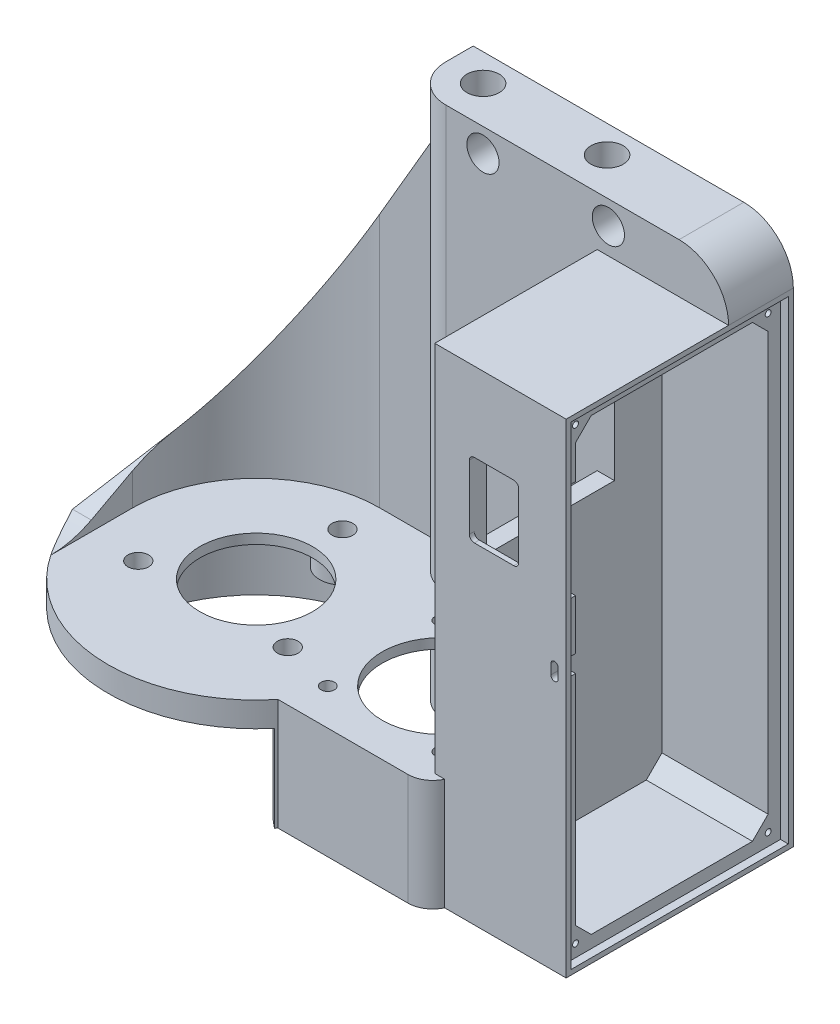
from build123d import *
from build123d.topology import SkipClean

# Parameters (mm, degrees)
SKETCH1_R                           = 12
SKETCH1_R_2                         = 11.425
BOSS_EXTRUDE1_DEPTH                 = 2
BOSS_EXTRUDE2_DEPTH                 = 73.934
BOSS_EXTRUDE2_DEPTH_BACK            = 21.066
M5X0_8_TAPPED_HOLE1_D               = 4.2
M2_5_CLEARANCE_HOLE1_D              = 2.7
BOSS_EXTRUDE4_DEPTH                 = 1.5
BOSS_EXTRUDE4_DEPTH_BACK            = 2
SKETCH8_W                           = 25
SKETCH8_H                           = 46
BOSS_EXTRUDE5_DEPTH                 = 1.5
BOSS_EXTRUDE5_DEPTH_BACK            = 2
SKETCH9_W                           = 25
SKETCH9_H                           = 46
BOSS_EXTRUDE34_DEPTH                = 21.5
BOSS_EXTRUDE17_DEPTH                = 38.21875
SKETCH44_W                          = 11.1125
SKETCH44_H                          = 62.3215
BOSS_EXTRUDE21_DEPTH                = 2
SKETCH46_W                          = 36.21875
SKETCH46_H                          = 11.1125
CUT_EXTRUDE12_DEPTH                 = 113.004120148
SKETCH47_W                          = 38.21875
SKETCH47_H                          = 13.1125
BOSS_EXTRUDE23_DEPTH                = 13.1125
BOSS_EXTRUDE22_DEPTH                = 71.775
F_1_4_CLEARANCE_HOLE3_D             = 6.5278
CUT_EXTRUDE5_DEPTH                  = 75.434
BOSS_EXTRUDE24_DEPTH                = 20.566
CUT_EXTRUDE13_START                 = -20.566
CUT_EXTRUDE13_DEPTH                 = 20.566
BOSS_EXTRUDE6_DEPTH                 = 5
CUT_EXTRUDE4_DEPTH                  = 113.004120148
BOSS_EXTRUDE7_REACH                 = 114.004
CUT_EXTRUDE8_DEPTH                  = 131.492286619
CUT_EXTRUDE8_DIRECTION_2_REACH      = 132.492
CUT_EXTRUDE8_DIRECTION_2_END_RADIUS = 25
BOSS_EXTRUDE15_START                = 20.566
BOSS_EXTRUDE15_DEPTH                = 20.566
SKETCH41_W                          = 29.3875
SKETCH41_H                          = 20
CUT_EXTRUDE10_DEPTH                 = 116.50578228
SKETCH70_R                          = 0.595
CUT_EXTRUDE17_DEPTH                 = 10
CUT_EXTRUDE19_DEPTH                 = 3.5
SKETCH72_W                          = 2
SKETCH72_H                          = 17.526
CUT_REVOLVE1_ANGLE                  = 50
CUT_REVOLVE1_OTHER_WAY_ANGLE        = 70
BOSS_EXTRUDE37_START                = 4.54
SKETCH73_R                          = 4.6
SKETCH73_R_2                        = 2.1
BOSS_EXTRUDE37_DEPTH                = 4.54
CUT_EXTRUDE20_REACH                 = 136.443
SKETCH76_W                          = 2.5
SKETCH76_H                          = 20
SKETCH78_W                          = 46
SKETCH78_H                          = 98
SKETCH78_W_2                        = 44
SKETCH78_H_2                        = 96
BOSS_EXTRUDE38_DEPTH                = 1.6
SKETCH81_W                          = 0.75
SKETCH81_H                          = 20
BOSS_EXTRUDE41_DEPTH                = 1
SKETCH82_W                          = 0.75
SKETCH82_H                          = 3.5
CUT_EXTRUDE22_DEPTH                 = 2.5
SKETCH84_W                          = 1.5
SKETCH84_H                          = 2.8875
CUT_EXTRUDE23_DEPTH                 = 2
SKETCH85_R                          = 3.2639
BOSS_EXTRUDE43_DEPTH                = 10.025
F_1_4_CLEARANCE_HOLE4_D             = 6.5278
SKETCH89_R                          = 3.2639
CUT_EXTRUDE24_DEPTH                 = 10.025
FILLET1_R                           = 3
FILLET2_R                           = 5
CUT_EXTRUDE25_DEPTH                 = 126.322803244


with BuildPart() as part:
    # Sketch1 → Boss-Extrude1 (new body)
    with BuildSketch(Plane(origin=(0, 0, 0), x_dir=(1, 0, 0), z_dir=(0, 1, 0))):
        with BuildLine():
            Line((77.166278738, 30), (0, 30))
            ThreePointArc((0, 30), (-27.079743352, -12.910751334), (23.30798884, -18.8875))
            Line((23.30798884, -18.8875), (55.666278738, -18.8875))
            Line((55.666278738, -18.8875), (55.666278738, -16))
            Line((55.666278738, -16), (77.166278738, -16))
            Line((77.166278738, -16), (77.166278738, -12.5))
            Line((77.166278738, -12.5), (55.666278738, -12.5))
            Line((55.666278738, -12.5), (55.666278738, 26.5))
            Line((55.666278738, 26.5), (77.166278738, 26.5))
            Line((77.166278738, 26.5), (77.166278738, 30))
        make_face()
        with Locations(Location((37.5, 0, 0), (0, 0, 270))):
            Circle(SKETCH1_R, mode=Mode.SUBTRACT)
        with Locations(Location((0, 0, 0), (0, 0, 270))):
            Circle(SKETCH1_R_2, mode=Mode.SUBTRACT)
    extrude(amount=-BOSS_EXTRUDE1_DEPTH)

    # Sketch1<3> → Boss-Extrude2 (add, two sides: drawn at the far end of the back side and taken through both)
    with BuildSketch(Plane(origin=(0, 0, 0), x_dir=(1, 0, 0), z_dir=(0, 1, 0)).offset(-BOSS_EXTRUDE2_DEPTH_BACK)):
        Polygon((77.166278738, 30), (52.166278738, 30), (52.166278738, -16), (55.666278738, -16), (77.166278738, -16), (77.166278738, -12.5), (55.666278738, -12.5), (55.666278738, 26.5), (77.166278738, 26.5), align=None)
    extrude(amount=BOSS_EXTRUDE2_DEPTH + BOSS_EXTRUDE2_DEPTH_BACK)

    # M5x0.8 Tapped Hole1 (through all)
    with Locations(Plane(origin=(0, 0, 0), x_dir=(1, 0, 0), z_dir=(0, 1, 0))):
        with Locations((0, 17.475), (-15.133793931, -8.7375), (15.133793931, -8.7375)):
            Hole(M5X0_8_TAPPED_HOLE1_D / 2)

    # M2.5 Clearance Hole1 (through all)
    with Locations(Plane(origin=(0, 0, 0), x_dir=(1, 0, 0), z_dir=(0, 1, 0))):
        with Locations((26, 11.5), (49, 11.5), (49, -11.5), (26, -11.5)):
            Hole(M2_5_CLEARANCE_HOLE1_D / 2)

    # Sketch8 → Boss-Extrude4 (add, two sides: drawn at the far end of the back side and taken through both)
    with BuildSketch(Plane(origin=(0, 73.934, 0), x_dir=(1, 0, 0), z_dir=(0, 1, 0)).offset(-BOSS_EXTRUDE4_DEPTH_BACK)):
        with Locations((64.666278738, 7)):
            Rectangle(SKETCH8_W, SKETCH8_H)
    extrude(amount=BOSS_EXTRUDE4_DEPTH + BOSS_EXTRUDE4_DEPTH_BACK)

    # Sketch9 → Boss-Extrude5 (add, two sides: drawn at the far end of the back side and taken through both)
    with BuildSketch(Plane.XZ.offset(21.066).offset(-BOSS_EXTRUDE5_DEPTH_BACK)):
        with Locations((64.666278738, -7)):
            Rectangle(SKETCH9_W, SKETCH9_H)
    extrude(amount=BOSS_EXTRUDE5_DEPTH + BOSS_EXTRUDE5_DEPTH_BACK)

    # Sketch65 → Boss-Extrude34 (add)
    with BuildSketch(Plane(origin=(55.666278738, 0, 0), x_dir=(0, 0, -1), z_dir=(1, 0, 0))):
        Polygon((-12.5, 71.934), (-9.325, 71.934), (-12.5, 68.759), align=None)
        Polygon((26.5, 71.934), (23.325, 71.934), (26.5, 68.759), align=None)
        Polygon((26.5, -15.891), (23.325, -19.066), (26.5, -19.066), align=None)
        Polygon((-9.325, -19.066), (-12.5, -15.891), (-12.5, -19.066), align=None)
    extrude(amount=BOSS_EXTRUDE34_DEPTH)

    # Sketch28 → Boss-Extrude17 (add)
    with BuildSketch(Plane.ZY.offset(-52.166278738)):
        Polygon((-18.8875, 62.3215), (-30, 62.3215), (-30, 75.434), (-16.8875, 75.434), (-16.8875, 0), (-18.8875, 0), align=None)
    extrude(amount=BOSS_EXTRUDE17_DEPTH)

    # Sketch44 → Boss-Extrude21 (add)
    with BuildSketch(Plane.ZY.offset(-13.947528738)):
        with Locations((-24.44375, 31.16075)):
            Rectangle(SKETCH44_W, SKETCH44_H)
    extrude(amount=-BOSS_EXTRUDE21_DEPTH)

    # Sketch46 → Cut-Extrude12 (cut, through all)
    with BuildSketch(Plane(origin=(0, 0, 0), x_dir=(1, 0, 0), z_dir=(0, 1, 0))):
        with Locations((34.056903738, 24.44375)):
            Rectangle(SKETCH46_W, SKETCH46_H)
    extrude(amount=-CUT_EXTRUDE12_DEPTH, mode=Mode.SUBTRACT)

    # Sketch47 → Boss-Extrude23 (add)
    with BuildSketch(Plane.XZ.offset(22.566)):
        with Locations((33.056903738, -23.44375)):
            Rectangle(SKETCH47_W, SKETCH47_H)
    extrude(amount=-BOSS_EXTRUDE23_DEPTH)

    # Sketch45 → Boss-Extrude22 (add)
    with BuildSketch(Plane(origin=(0, -9.4535, 0), x_dir=(1, 0, 0), z_dir=(0, 1, 0))):
        with BuildLine():
            Line((21.503778738, 18.8875), (15.947528738, 18.8875))
            Line((15.947528738, 18.8875), (15.947528738, 24.44375))
            ThreePointArc((15.947528738, 24.44375), (17.574916685, 20.514887947), (21.503778738, 18.8875))
        make_face()
        with BuildLine():
            Line((52.166278738, 18.8875), (46.610028738, 18.8875))
            ThreePointArc((46.610028738, 18.8875), (50.538890791, 20.514887947), (52.166278738, 24.44375))
            Line((52.166278738, 24.44375), (52.166278738, 18.8875))
        make_face()
    extrude(amount=BOSS_EXTRUDE22_DEPTH)

    # 1/4 Clearance Hole3 (through all)
    with Locations(Plane(origin=(0, 75.434, 0), x_dir=(1, 0, 0), z_dir=(0, 1, 0))):
        with Locations((46.610028738, 24.44375), (21.503778738, 24.44375)):
            Hole(F_1_4_CLEARANCE_HOLE3_D / 2)

    # Sketch32 → Cut-Extrude5 (cut)
    with BuildSketch(Plane(origin=(0, 75.434, 0), x_dir=(1, 0, 0), z_dir=(0, 1, 0))):
        with BuildLine():
            Line((21.503778738, 16.8875), (13.947528738, 16.8875))
            Line((13.947528738, 16.8875), (13.947528738, 24.44375))
            ThreePointArc((13.947528738, 24.44375), (16.160703122, 19.100674385), (21.503778738, 16.8875))
        make_face()
    extrude(amount=-CUT_EXTRUDE5_DEPTH, mode=Mode.SUBTRACT)

    # Sketch48 → Boss-Extrude24 (add)
    with BuildSketch(Plane.XZ.offset(22.566)):
        Polygon((52.166278738, -18.8875), (52.166278738, -16.8875), (13.947528738, -16.8875), (13.947528738, -30), (15.947528738, -30), (15.947528738, -18.8875), align=None)
    extrude(amount=-BOSS_EXTRUDE24_DEPTH)

    # Sketch49 → Cut-Extrude13 (cut)
    with BuildSketch(Plane.XZ.offset(22.566).offset(CUT_EXTRUDE13_START)):
        with BuildLine():
            Line((13.947528738, -24.44375), (13.947528738, -16.8875))
            Line((13.947528738, -16.8875), (21.503778738, -16.8875))
            ThreePointArc((21.503778738, -16.8875), (16.160703122, -19.100674385), (13.947528738, -24.44375))
        make_face()
    extrude(amount=CUT_EXTRUDE13_DEPTH, mode=Mode.SUBTRACT)

    # Sketch12 → Boss-Extrude6 (add)
    with BuildSketch(Plane(origin=(0, 0, -30), x_dir=(-1, 0, 0), z_dir=(0, 0, -1))):
        Polygon((-13.947528738, 75.434), (30, 0), (-13.947528738, 0), align=None)
    extrude(amount=-BOSS_EXTRUDE6_DEPTH)

    # Sketch14 → Cut-Extrude4 (cut, through all)
    with BuildSketch(Plane.XZ):
        with BuildLine():
            ThreePointArc((0, -30), (-21.213203436, -21.213203436), (-30, 0))
            Line((-30, 0), (-30, -30))
            Line((-30, -30), (0, -30))
        make_face()
        with BuildLine():
            Line((-30, 30), (-30, 0))
            ThreePointArc((-30, 0), (-21.213203436, 21.213203436), (0, 30))
            Line((0, 30), (-30, 30))
        make_face()
    extrude(amount=-CUT_EXTRUDE4_DEPTH, mode=Mode.SUBTRACT)

    # Boss-Extrude7: up to this face of the body (flat: up to its plane)
    boss_extrude7_end = Plane(part.part.faces().sort_by_distance((1.048887243, 53.294049235, -27.283424516))[0])
    # Sketch17 → Boss-Extrude7 (add, up to the picked face)
    with BuildSketch(Plane(origin=(0, 0, 0), x_dir=(1, 0, 0), z_dir=(0, 1, 0)), mode=Mode.PRIVATE) as boss_extrude7_sk1:
        with BuildLine():
            Line((0, 25), (-16.583123952, 25))
            ThreePointArc((-16.583123952, 25), (-29.403708929, 5.95163013), (-25, -16.583123952))
            Line((-25, -16.583123952), (-25, 0))
            ThreePointArc((-25, 0), (-17.67766953, 17.67766953), (0, 25))
        make_face()
    boss_extrude7_tool1 = split(extrude(boss_extrude7_sk1.sketch, amount=BOSS_EXTRUDE7_REACH, mode=Mode.PRIVATE), bisect_by=boss_extrude7_end, keep=Keep.BOTH, mode=Mode.PRIVATE)
    add(boss_extrude7_tool1.solids().sort_by(Axis((-18.040241, 0, -18.040241), (0, 1, 0)))[0])

    # Sketch37 → Cut-Extrude8 (cut)
    with BuildSketch(Plane(origin=(-25, 0, 0), x_dir=(0, 0, -1), z_dir=(1, 0, 0))):
        with BuildLine():
            Line((-8.389768282, 2.054628266), (7.441644952, 10.52744792))
            Line((7.441644952, 10.52744792), (-16.583123952, 10.52744792))
            Line((-16.583123952, 10.52744792), (-16.583123952, 0))
            ThreePointArc((-16.583123952, 0), (-12.359601298, 0.521487976), (-8.389768282, 2.054628266))
        make_face()
    extrude(amount=-CUT_EXTRUDE8_DEPTH, mode=Mode.SUBTRACT)

    # Cut-Extrude8 direction 2: up to this cylinder (the profile starts outside it)
    cut_extrude8_direction_2_end = Plane(origin=(0, 6.542538, 0), z_dir=(0, -1, 0)) * Cylinder(CUT_EXTRUDE8_DIRECTION_2_END_RADIUS, 315.984, mode=Mode.PRIVATE)
    # Sketch37 → Cut-Extrude8 direction 2 (cut, up to the surface)
    with BuildSketch(Plane(origin=(-25, 0, 0), x_dir=(0, 0, -1), z_dir=(1, 0, 0)), mode=Mode.PRIVATE) as cut_extrude8_direction_2_sk1:
        with BuildLine():
            Line((-8.389768282, 2.054628266), (7.441644952, 10.52744792))
            Line((7.441644952, 10.52744792), (-16.583123952, 10.52744792))
            Line((-16.583123952, 10.52744792), (-16.583123952, 0))
            ThreePointArc((-16.583123952, 0), (-12.359601298, 0.521487976), (-8.389768282, 2.054628266))
        make_face()
    cut_extrude8_direction_2_tool1 = extrude(cut_extrude8_direction_2_sk1.sketch, amount=CUT_EXTRUDE8_DIRECTION_2_REACH, mode=Mode.PRIVATE) - cut_extrude8_direction_2_end
    add(cut_extrude8_direction_2_tool1.solids().sort_by_distance((-25, 6.542538, 8.31104))[0], mode=Mode.SUBTRACT)
    add(cut_extrude8_direction_2_tool1.solids().sort_by_distance((-25, 6.542538, 8.31104))[1], mode=Mode.SUBTRACT)

    # Sketch26 → Boss-Extrude15 (add)
    with BuildSketch(Plane.XZ.offset(2).offset(BOSS_EXTRUDE15_START)):
        with BuildLine():
            Line((13.947528738, -30), (0, -30))
            ThreePointArc((0, -30), (-27.079743352, 12.910751334), (23.30798884, 18.8875))
            Line((23.30798884, 18.8875), (52.166278738, 18.8875))
            Line((52.166278738, 18.8875), (54.166278738, 18.8875))
            Line((54.166278738, 18.8875), (54.166278738, 16))
            Line((54.166278738, 16), (52.166278738, 16))
            Line((52.166278738, 16), (52.166278738, 16.8875))
            Line((52.166278738, 16.8875), (22.334107185, 16.8875))
            ThreePointArc((22.334107185, 16.8875), (-25.068406411, 12.472970777), (0, -28))
            Line((0, -28), (13.947528738, -28))
            Line((13.947528738, -28), (13.947528738, -30))
        make_face()
    extrude(amount=-BOSS_EXTRUDE15_DEPTH)

    # Sketch41 → Cut-Extrude10 (cut, through all)
    with BuildSketch(Plane.ZY.offset(-52.166278738)):
        with Locations((-2.19375, 46.65972209)):
            Rectangle(SKETCH41_W, SKETCH41_H)
    extrude(amount=-CUT_EXTRUDE10_DEPTH, mode=Mode.SUBTRACT)

    # Sketch70 → Cut-Extrude17 (cut)
    with BuildSketch(Plane(origin=(77.166278738, 0, 0), x_dir=(0, 0, -1), z_dir=(1, 0, 0))):
        with Locations((-12.5, 71.934)):
            Circle(SKETCH70_R)
        with Locations((26.5, 71.934)):
            Circle(SKETCH70_R)
        with Locations((26.5, -19.066)):
            Circle(SKETCH70_R)
        with Locations((-12.5, -19.066)):
            Circle(SKETCH70_R)
    extrude(amount=-CUT_EXTRUDE17_DEPTH, mode=Mode.SUBTRACT)

    # Sketch71 → Cut-Extrude19 (cut)
    with BuildSketch(Plane.XY.offset(16)):
        with BuildLine():
            Line((60.166278738, 59.434), (68.166278738, 59.434))
            ThreePointArc((68.166278738, 59.434), (68.873385519, 59.141106781), (69.166278738, 58.434))
            Line((69.166278738, 58.434), (69.166278738, 45.434))
            ThreePointArc((69.166278738, 45.434), (68.873385519, 44.726893219), (68.166278738, 44.434))
            Line((68.166278738, 44.434), (60.166278738, 44.434))
            ThreePointArc((60.166278738, 44.434), (59.459171957, 44.726893219), (59.166278738, 45.434))
            Line((59.166278738, 45.434), (59.166278738, 58.434))
            ThreePointArc((59.166278738, 58.434), (59.459171957, 59.141106781), (60.166278738, 59.434))
        make_face()
        with BuildLine():
            Line((75.666278738, 31.034), (75.666278738, 29.034))
            ThreePointArc((75.666278738, 29.034), (76.416278738, 28.284), (77.166278738, 29.034))
            Line((77.166278738, 29.034), (77.166278738, 31.034))
            ThreePointArc((77.166278738, 31.034), (76.416278738, 31.784), (75.666278738, 31.034))
        make_face()
    extrude(amount=-CUT_EXTRUDE19_DEPTH, mode=Mode.SUBTRACT)

    # Sketch72 → Cut-Revolve1 (revolve, cut)
    with BuildSketch(Plane.ZY):
        with Locations((29, -13.803)):
            Rectangle(SKETCH72_W, SKETCH72_H)
    revolve(axis=Axis((0, -125.929254963, 0), (0, 1, 0)), revolution_arc=CUT_REVOLVE1_ANGLE, mode=Mode.SUBTRACT)

    # Sketch72 → Cut-Revolve1 other way (revolve, cut)
    with BuildSketch(Plane.ZY):
        with Locations((29, -13.803)):
            Rectangle(SKETCH72_W, SKETCH72_H)
    revolve(axis=Axis((0, -125.929254963, 0), (0, -1, 0)), revolution_arc=CUT_REVOLVE1_OTHER_WAY_ANGLE, mode=Mode.SUBTRACT)

    # Sketch73 → Boss-Extrude37 (add)
    # profile 1 of 3: a face of its own
    with BuildSketch(Plane.XZ.offset(2).offset(BOSS_EXTRUDE37_START)):
        with Locations(Location((-15.133793931, 8.7375, 0), (0, 0, 90))):
            Circle(SKETCH73_R)
        with Locations(Location((-15.133793931, 8.7375, 0), (0, 0, 90))):
            Circle(SKETCH73_R_2, mode=Mode.SUBTRACT)
    # profile 2 of 3: a face of its own
    with BuildSketch(Plane.XZ.offset(2).offset(BOSS_EXTRUDE37_START)):
        with Locations(Location((15.133793931, 8.7375, 0), (0, 0, 90))):
            Circle(SKETCH73_R)
        with Locations(Location((15.133793931, 8.7375, 0), (0, 0, 90))):
            Circle(SKETCH73_R_2, mode=Mode.SUBTRACT)
    # profile 3 of 3: a face of its own
    with BuildSketch(Plane.XZ.offset(2).offset(BOSS_EXTRUDE37_START)):
        with Locations(Location((0, -17.475, 0), (0, 0, 90))):
            Circle(SKETCH73_R)
        with Locations(Location((0, -17.475, 0), (0, 0, 90))):
            Circle(SKETCH73_R_2, mode=Mode.SUBTRACT)
    extrude(amount=-BOSS_EXTRUDE37_DEPTH)

    # Cut-Extrude20: up to this face of the body (flat: up to its plane)
    cut_extrude20_end = Plane(part.part.faces().sort_by_distance((59.166278738, 51.934, 14.25))[0])
    # Sketch76 → Cut-Extrude20 (cut, up to the picked face)
    with BuildSketch(Plane(origin=(77.166278738, 0, 0), x_dir=(0, 0, -1), z_dir=(1, 0, 0)), mode=Mode.PRIVATE) as cut_extrude20_sk1:
        with Locations((-13.75, 51.934)):
            Rectangle(SKETCH76_W, SKETCH76_H)
    cut_extrude20_tool1 = split(extrude(cut_extrude20_sk1.sketch, amount=-CUT_EXTRUDE20_REACH, mode=Mode.PRIVATE), bisect_by=cut_extrude20_end, keep=Keep.BOTH, mode=Mode.PRIVATE)
    add(cut_extrude20_tool1.solids().sort_by(Axis((77.166279, 51.934, 13.75), (-1, 0, 0)))[0], mode=Mode.SUBTRACT)

    # Sketch78 → Boss-Extrude38 (add)
    with BuildSketch(Plane(origin=(77.166278738, 0, 0), x_dir=(0, 0, -1), z_dir=(1, 0, 0))):
        with Locations((7, 26.434)):
            Rectangle(SKETCH78_W, SKETCH78_H)
        with Locations((7, 26.434)):
            Rectangle(SKETCH78_W_2, SKETCH78_H_2, mode=Mode.SUBTRACT)
    extrude(amount=BOSS_EXTRUDE38_DEPTH)

    # Sketch81 → Boss-Extrude41 (add)
    with BuildSketch(Plane(origin=(77.166278738, 0, 0), x_dir=(0, 0, -1), z_dir=(1, 0, 0))):
        with Locations((-14.625, 51.934)):
            Rectangle(SKETCH81_W, SKETCH81_H)
    extrude(amount=-BOSS_EXTRUDE41_DEPTH)

    # Sketch82 → Cut-Extrude22 (cut)
    with BuildSketch(Plane(origin=(0, 0, 12.5), x_dir=(-1, 0, 0), z_dir=(0, 0, -1))):
        with Locations((-76.791278738, 30.034)):
            Rectangle(SKETCH82_W, SKETCH82_H)
    extrude(amount=-CUT_EXTRUDE22_DEPTH, mode=Mode.SUBTRACT)

    # Sketch84 → Cut-Extrude23 (cut)
    with BuildSketch(Plane.XZ.offset(2)):
        with Locations((54.916278738, 17.44375)):
            Rectangle(SKETCH84_W, SKETCH84_H)
    extrude(amount=-CUT_EXTRUDE23_DEPTH, mode=Mode.SUBTRACT)

    # Sketch85 → Boss-Extrude43 (add)
    with BuildSketch(Plane(origin=(0, 75.434, 0), x_dir=(1, 0, 0), z_dir=(0, 1, 0))):
        with BuildLine():
            Line((13.947528738, 30), (78.766278738, 30))
            Line((78.766278738, 30), (78.766278738, 16.8875))
            Line((78.766278738, 16.8875), (21.503778738, 16.8875))
            ThreePointArc((21.503778738, 16.8875), (16.160703122, 19.100674385), (13.947528738, 24.44375))
            Line((13.947528738, 24.44375), (13.947528738, 30))
        make_face()
        with Locations(Location((21.503778738, 24.44375, 0), (0, 0, 270))):
            Circle(SKETCH85_R, mode=Mode.SUBTRACT)
        with Locations(Location((46.610028738, 24.44375, 0), (0, 0, 270))):
            Circle(SKETCH85_R, mode=Mode.SUBTRACT)
    extrude(amount=BOSS_EXTRUDE43_DEPTH)

    # 1/4 Clearance Hole4 (through all)
    with Locations(Plane.XY.offset(-16.8875)):
        with Locations((29.031578738, 80.6965), (54.431578738, 80.6965)):
            Hole(F_1_4_CLEARANCE_HOLE4_D / 2)

    # Sketch89 → Cut-Extrude24 (cut)
    with SkipClean():  # the faces are left unmerged after this step: merging them gives an invalid solid
        with BuildSketch(Plane.XZ.offset(-62.3215)):
            with BuildLine():
                Line((15.947528738, -30), (15.947528738, -24.44375))
                ThreePointArc((15.947528738, -24.44375), (17.574916685, -20.514887947), (21.503778738, -18.8875))
                Line((21.503778738, -18.8875), (46.610028738, -18.8875))
                ThreePointArc((46.610028738, -18.8875), (50.538890791, -20.514887947), (52.166278738, -24.44375))
                Line((52.166278738, -24.44375), (52.166278738, -30))
                Line((52.166278738, -30), (15.947528738, -30))
            make_face()
            with Locations(Location((21.503778738, -24.44375, 0), (0, 0, 90))):
                Circle(SKETCH89_R, mode=Mode.SUBTRACT)
            with Locations(Location((46.610028738, -24.44375, 0), (0, 0, 90))):
                Circle(SKETCH89_R, mode=Mode.SUBTRACT)
        extrude(amount=-CUT_EXTRUDE24_DEPTH, mode=Mode.SUBTRACT)

    # Fillet1
    fillet1_edges = [part.edges().sort_by_distance(p)[0] for p in [
        (52.166278738, -12.283, -16.8875),
        (52.166278738, -12.283, 16.8875),
    ]]
    fillet(fillet1_edges, radius=FILLET1_R)

    # Fillet2
    # the kernel refuses this fillet: 5 mm, written as the material it takes off along each edge
    with BuildSketch(Plane(origin=(54.166278738, -33.89553655, 18.8875), x_dir=(-1, 0, 0), z_dir=(0, 1, 0))) as fillet2_piece_1:
        with BuildLine():
            CenterArc((4.53181462, -5), FILLET2_R, 90, 65.007476149)
            Line((0, -2.8875), (-0.090636292, -2.84525))
            ThreePointArc((-0.090636292, -2.84525), (-0.1, -1.44375), (-0.1, 0))
            Line((-0.1, 0), (0, 0.1))
            Line((0, 0.1), (4.53181462, 0.1))
            Line((4.53181462, 0.1), (4.53181462, 0))
        make_face()
    extrude(amount=45.2250731, mode=Mode.SUBTRACT)

    # Sketch90 → Cut-Extrude25 (cut, through all)
    with SkipClean():  # the faces are left unmerged after this step: merging them gives an invalid solid
        with BuildSketch(Plane.XY.offset(-16.8875)):
            with BuildLine():
                Line((78.766278738, 75.434), (78.766278738, 85.459))
                Line((78.766278738, 85.459), (68.741278738, 85.459))
                ThreePointArc((68.741278738, 85.459), (75.830024219, 82.522745481), (78.766278738, 75.434))
            make_face()
        extrude(amount=-CUT_EXTRUDE25_DEPTH, mode=Mode.SUBTRACT)


solid = part.part
